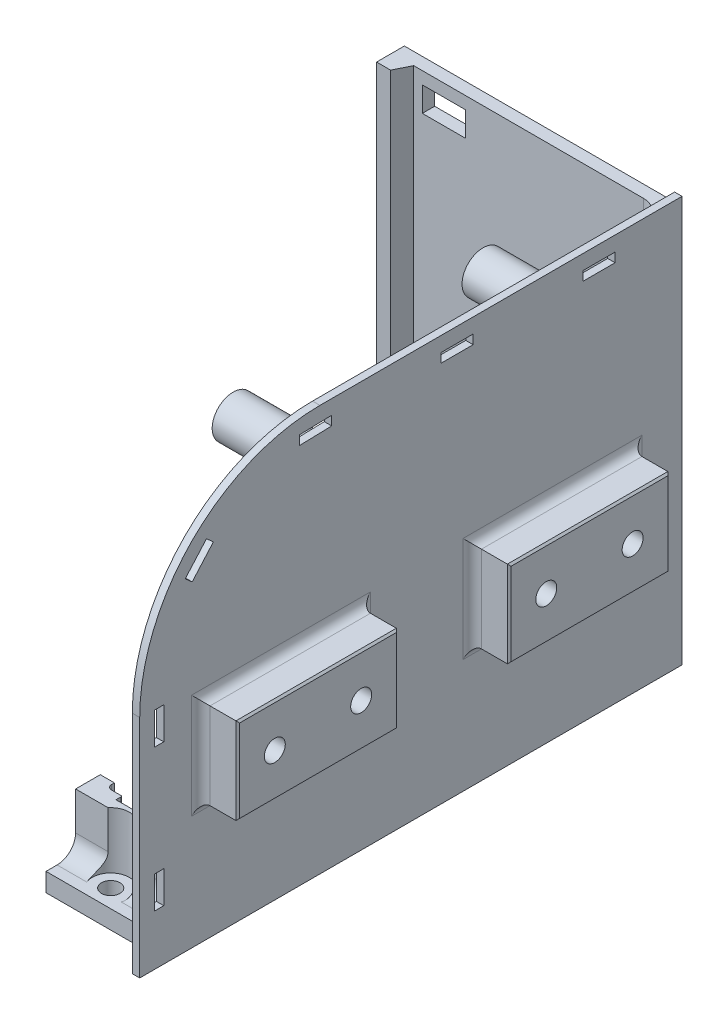
from build123d import *

# Parameters (mm, degrees)
EXTRUDE_1_DEPTH                 = 2
EXTRUDE_2_DEPTH                 = 1.2
SKETCH_4_R                      = 1.55
EXTRUDE_3_DEPTH                 = 4
EXTRUDE_START                   = 3
SKETCH_4_3_R                    = 1.55
EXTRUDE_4_DEPTH                 = 4
FILLET_1_R                      = 3
SKETCH_5_W                      = 3.5
SKETCH_5_H                      = 2.5
EXTRUDE_5_DEPTH                 = 59.375418161
SKETCH_9_W                      = 7
SKETCH_9_H                      = 4
CUT_EXTRUDE_3_DEPTH             = 2
OTHER_START                     = -350.004341608
OTHER_1_OUTLINE_W               = 1.5
OTHER_1_OUTLINE_H               = 5.2
OTHER_1_OUTLINE_W_2             = 5.2
OTHER_1_OUTLINE_H_2             = 1.5
OTHER_1_DEPTH                   = 1.2
SKETCH_10_R                     = 3.4
SKETCH_10_R_2                   = 1.4
EXTRUDE_6_DEPTH                 = 13.8
EXTRUDE_7_DEPTH                 = 2.4
CHAMFER_1_SIZE2                 = 1.219331471
CHAMFER_1_SIZE                  = 2.5
EXTRUDE_9_DEPTH                 = 15.389983971
SKETCH_15_R                     = 1.5
CUT_EXTRUDE_4_DEPTH             = 407.679532375
FILLET_2_R                      = 3
SKETCH_16_R                     = 3
CUT_EXTRUDE_5_DEPTH             = 408.922716855
SKETCH_17_W                     = 26
SKETCH_17_H                     = 14
EXTRUDE_10_DEPTH                = 6
CUT_EXTRUDE_6_REACH             = 113.55
SKETCH_18_R                     = 1.7
CUT_EXTRUDE_6_DIRECTION_2_DEPTH = 112.550133095
PATTERN_LINEAR_1_COUNT          = 2
PATTERN_LINEAR_1_PITCH          = 44
FILLET_3_R                      = 1.5
CHAMFER_2_SIZE                  = 0.3


# Read off the part's stored shape, not the designer's step: Отступ1
# Some blends are built 0.0001 mm under size
with BuildPart() as part:
    # Эскиз2 → Бобышка-Вытянуть1 (new body)
    with BuildSketch(Plane.XY.offset(0.1)):
        Polygon((-376.904341608, -14.952219826), (-393.804341608, -14.952219826), (-393.804341608, 44.423198335), (-348.804341608, 44.423198335), (-348.804341608, -19.952219826), (-376.904341608, -19.952219826), align=None)
    extrude(amount=EXTRUDE_1_DEPTH)

    # Эскиз3 → Бобышка-Вытянуть2 (add)
    with BuildSketch(Plane(origin=(-348.804341608, 0, 0), x_dir=(0, 0, -1), z_dir=(1, 0, 0))):
        with BuildLine():
            Line((-0.1, -19.952219826), (-0.1, 45.823198335))
            Line((-0.1, 45.823198335), (-58.7849644, 45.823198335))
            ThreePointArc((-58.7849644, 45.823198335), (-79.43775717, 37.268531468), (-87.992424037, 16.615738698))
            Line((-87.992424037, 16.615738698), (-87.992424037, -19.952219826))
            Line((-87.992424037, -19.952219826), (-0.1, -19.952219826))
        make_face()
    extrude(amount=-EXTRUDE_2_DEPTH)

    # Эскиз4 → Бобышка-Вытянуть3 (add)
    with BuildSketch(Plane(origin=(0, -17.952219826, 0), x_dir=(1, 0, 0), z_dir=(0, 1, 0))):
        with BuildLine():
            Line((-357.604341608, -2.1), (-357.604341608, -5.7))
            ThreePointArc((-357.604341608, -5.7), (-356.608504664, -8.104163056), (-354.204341608, -9.1))
            Line((-354.204341608, -9.1), (-350.004341608, -9.1))
            Line((-350.004341608, -9.1), (-350.004341608, -2.1))
            Line((-350.004341608, -2.1), (-357.604341608, -2.1))
        make_face()
        with Locations(Location((-354.204341608, -5.7, 0), (0, 0, 270))):
            Circle(SKETCH_4_R, mode=Mode.SUBTRACT)
    extrude(amount=EXTRUDE_3_DEPTH)

    # Эскиз4<3> → Бобышка-Вытянуть4 (add)
    with BuildSketch(Plane(origin=(0, -17.952219826, 0), x_dir=(1, 0, 0), z_dir=(0, 1, 0)).offset(EXTRUDE_START)):
        with BuildLine():
            Line((-390.304341608, -5.7), (-390.304341608, -2.1))
            Line((-390.304341608, -2.1), (-381.365657691, -2.1))
            Line((-381.365657691, -2.1), (-383.84844185, -7.190461899))
            ThreePointArc((-383.84844185, -7.190461899), (-387.669175192, -9.01285822), (-390.304341608, -5.7))
        make_face()
        with Locations(Location((-386.904341608, -5.7, 0), (0, 0, 180))):
            Circle(SKETCH_4_3_R, mode=Mode.SUBTRACT)
    extrude(amount=EXTRUDE_4_DEPTH)

    # Скругление1
    fillet_1_edges = [part.edges().sort_by_distance(p)[0] for p in [
        (-350.004341608, -18.952219826, 2.1),
        (-350.004341608, 15.235489254, 2.1),
    ]]
    fillet(fillet_1_edges, radius=FILLET_1_R)

    # Эскиз5 → Бобышка-Вытянуть5 (add)
    with BuildSketch(Plane(origin=(0, 44.423198335, 0), x_dir=(1, 0, 0), z_dir=(0, 1, 0))):
        with Locations((-392.054341608, -3.35)):
            Rectangle(SKETCH_5_W, SKETCH_5_H)
    extrude(amount=-EXTRUDE_5_DEPTH)

    # Эскиз9 → Вырез-Вытянуть3 (cut)
    with BuildSketch(Plane(origin=(0, 0, 0.1), x_dir=(-1, 0, 0), z_dir=(0, 0, -1))):
        with Locations((385.390488384, 40.423198335)):
            Rectangle(SKETCH_9_W, SKETCH_9_H)
    extrude(amount=-CUT_EXTRUDE_3_DEPTH, mode=Mode.SUBTRACT)

    # Отступ1 outline → Отступ1 (cut)
    with BuildSketch(Plane.YZ.offset(OTHER_START)):
        with Locations((42.673198335, 13.546937644)):
            Rectangle(OTHER_1_OUTLINE_W, OTHER_1_OUTLINE_H)
        with Locations((42.673198335, 36.546937644)):
            Rectangle(OTHER_1_OUTLINE_W, OTHER_1_OUTLINE_H)
        Polygon((41.843105902, 62.072434127), (41.984560077, 56.874358452), (43.484004983, 56.915162541), (43.342550808, 62.113238216), align=None)
        Polygon((31.397725301, 79.490528515), (35.298941914, 76.052431812), (36.290700579, 77.177782758), (32.389483966, 80.615879461), align=None)
        with Locations((13.847780174, 84.842424037)):
            Rectangle(OTHER_1_OUTLINE_W_2, OTHER_1_OUTLINE_H_2)
        with Locations((-9.152219826, 84.842424037)):
            Rectangle(OTHER_1_OUTLINE_W_2, OTHER_1_OUTLINE_H_2)
    extrude(amount=OTHER_1_DEPTH, mode=Mode.SUBTRACT)

    # Эскиз10 → Бобышка-Вытянуть6 (add)
    # profile 1 of 2: a face of its own
    with BuildSketch(Plane.ZY.offset(350.004341608)):
        with Locations(Location((57.85, 36.323198334, 0), (0, 0, 180))):
            Circle(SKETCH_10_R)
        with Locations(Location((57.85, 36.323198334, 0), (0, 0, 180))):
            Circle(SKETCH_10_R_2, mode=Mode.SUBTRACT)
    # profile 2 of 2: a face of its own
    with BuildSketch(Plane.ZY.offset(350.004341608)):
        with Locations(Location((17.35, 36.323198334, 0), (0, 0, 180))):
            Circle(SKETCH_10_R)
        with Locations(Location((17.35, 36.323198334, 0), (0, 0, 180))):
            Circle(SKETCH_10_R_2, mode=Mode.SUBTRACT)
    extrude(amount=EXTRUDE_6_DEPTH)

    # Эскиз12 → Бобышка-Вытянуть7 (add)
    with BuildSketch(Plane.ZY.offset(350.004341608)):
        with BuildLine():
            Line((77.792424037, 16.615738698), (77.792424037, -19.952219826))
            Line((77.792424037, -19.952219826), (79.792424037, -19.952219826))
            Line((79.792424037, -19.952219826), (79.792424037, 16.615738698))
            ThreePointArc((79.792424037, 16.615738698), (73.639481564, 31.470255863), (58.7849644, 37.623198335))
            Line((58.7849644, 37.623198335), (0.1, 37.623198335))
            Line((0.1, 37.623198335), (0.1, 35.623198335))
            Line((0.1, 35.623198335), (58.7849644, 35.623198335))
            ThreePointArc((58.7849644, 35.623198335), (72.225268002, 30.0560423), (77.792424037, 16.615738698))
        make_face()
    extrude(amount=EXTRUDE_7_DEPTH)

    # Фаска1
    chamfer_1_edges = [part.edges().sort_by_distance(p)[0] for p in [
        (-390.304341608, 16.735489254, 4.6),
    ]]
    chamfer_1_side = [part.faces().sort_by_distance(p)[0] for p in [
        (-390.304341608, 16.735489254, 4.575613371),
    ]]
    chamfer(chamfer_1_edges, length=CHAMFER_1_SIZE - 0.0001, length2=CHAMFER_1_SIZE2 - 0.0001, reference=chamfer_1_side[0])  # a hair under: the kernel refuses the full size

    # Эскиз14 → Бобышка-Вытянуть9 (add)
    with BuildSketch(Plane.ZY.offset(350.004341608)):
        Polygon((77.792424037, -16.979951829), (86.592424037, -16.979951829), (86.592424037, -13.979951829), (81.792424037, -13.979951829), (81.792424037, -4.809951829), (77.792424037, -4.809951829), align=None)
    extrude(amount=EXTRUDE_9_DEPTH)

    # Эскиз15 → Вырез-Вытянуть4 (cut, through all)
    with BuildSketch(Plane(origin=(0, -4.809951829, 0), x_dir=(1, 0, 0), z_dir=(0, 1, 0))):
        with Locations(Location((-357.804325578, -83.692424037, 0), (0, 0, 270))):
            Circle(SKETCH_15_R)
        with BuildLine():
            Line((-363.104325578, -78.236115217), (-363.104325578, -76.736115217))
            Line((-363.104325578, -76.736115217), (-352.504325578, -76.736115217))
            Line((-352.504325578, -76.736115217), (-352.504325578, -78.236115217))
            ThreePointArc((-352.504325578, -78.236115217), (-352.738640153, -78.801800642), (-353.304325578, -79.036115217))
            Line((-353.304325578, -79.036115217), (-354.804325578, -79.036115217))
            ThreePointArc((-354.804325578, -79.036115217), (-354.945746935, -79.09469386), (-355.004325578, -79.236115217))
            Line((-355.004325578, -79.236115217), (-355.004325578, -80.036115217))
            Line((-355.004325578, -80.036115217), (-360.604325578, -80.036115217))
            Line((-360.604325578, -80.036115217), (-360.604325578, -79.236115217))
            ThreePointArc((-360.604325578, -79.236115217), (-360.662904222, -79.09469386), (-360.804325578, -79.036115217))
            Line((-360.804325578, -79.036115217), (-362.304325578, -79.036115217))
            ThreePointArc((-362.304325578, -79.036115217), (-362.870011003, -78.801800642), (-363.104325578, -78.236115217))
        make_face()
    extrude(amount=-CUT_EXTRUDE_4_DEPTH, mode=Mode.SUBTRACT)

    # Скругление2
    # the kernel refuses this fillet: 3 mm, written as the material it adds along each edge
    with BuildSketch(Plane(origin=(-350.004341608, -13.979951829, 81.792424037), x_dir=(0, 1, 0), z_dir=(-1, 0, 0))) as fillet_2_piece_1_section:
        with BuildLine():
            CenterArc((FILLET_2_R, -FILLET_2_R), FILLET_2_R, 90, 90)
            Line((0, -FILLET_2_R), (0, 0))
            Line((0, 0), (FILLET_2_R, 0))
        make_face()
    fillet_2_piece_1 = extrude(amount=15.389983971, mode=Mode.PRIVATE)
    fillet_2_piece_1 = fillet_2_piece_1 - Plane(origin=(-357.804325578, -11.764674138, 83.692424037), x_dir=(0, 0, 1), z_dir=(0, 1, 0)) * Cylinder(1.5, 43, mode=Mode.PRIVATE)
    add(fillet_2_piece_1)

    # Эскиз16 → Вырез-Вытянуть5 (cut, through all)
    with BuildSketch(Plane(origin=(0, -13.979951829, 0), x_dir=(1, 0, 0), z_dir=(0, 1, 0))):
        with Locations((-357.804325578, -83.692424037)):
            Circle(SKETCH_16_R)
    extrude(amount=CUT_EXTRUDE_5_DEPTH, mode=Mode.SUBTRACT)

    # Эскиз17 → Бобышка-Вытянуть10 (add)
    with BuildSketch(Plane(origin=(-348.804341608, 0, 0), x_dir=(0, 0, -1), z_dir=(1, 0, 0))):
        with Locations((-21.1, 7.047780174)):
            Rectangle(SKETCH_17_W, SKETCH_17_H)
    extrude_10 = extrude(amount=EXTRUDE_10_DEPTH)

    # Эскиз18 → Вырез-Вытянуть6 (cut, up to next)
    with BuildSketch(Plane(origin=(-342.804341608, 0, 0), x_dir=(0, 0, -1), z_dir=(1, 0, 0)), mode=Mode.PRIVATE) as cut_extrude_6_sk1:
        with Locations((-14.1, 7.047780174)):
            Circle(SKETCH_18_R)
    cut_extrude_6_tool1 = extrude(cut_extrude_6_sk1.sketch, amount=-CUT_EXTRUDE_6_REACH, mode=Mode.PRIVATE) & part.part
    # Эскиз18 → Вырез-Вытянуть6 (cut, up to next)
    with BuildSketch(Plane(origin=(-342.804341608, 0, 0), x_dir=(0, 0, -1), z_dir=(1, 0, 0)), mode=Mode.PRIVATE) as cut_extrude_6_sk2:
        with Locations(Location((-28.1, 7.047780174, 0), (0, 0, 180))):
            Circle(SKETCH_18_R)
    cut_extrude_6_tool2 = extrude(cut_extrude_6_sk2.sketch, amount=-CUT_EXTRUDE_6_REACH, mode=Mode.PRIVATE) & part.part
    cut_extrude_6_1 = cut_extrude_6_tool1.solids().sort_by_distance((-342.804342, 7.04778, 14.1))[0]
    add(cut_extrude_6_1, mode=Mode.SUBTRACT)
    cut_extrude_6_2 = cut_extrude_6_tool2.solids().sort_by_distance((-342.804342, 7.04778, 28.1))[0]
    add(cut_extrude_6_2, mode=Mode.SUBTRACT)
    cut_extrude_6 = cut_extrude_6_1 + cut_extrude_6_2  # Вырез-Вытянуть6 as one shape, for the pattern or mirror that repeats it

    # Эскиз18 → Вырез-Вытянуть6 direction 2 (cut)
    with BuildSketch(Plane(origin=(-342.804341608, 0, 0), x_dir=(0, 0, -1), z_dir=(1, 0, 0))):
        with Locations((-14.1, 7.047780174)):
            Circle(SKETCH_18_R)
        with Locations(Location((-28.1, 7.047780174, 0), (0, 0, 180))):
            Circle(SKETCH_18_R)
    cut_extrude_6_direction_2 = extrude(amount=CUT_EXTRUDE_6_DIRECTION_2_DEPTH, mode=Mode.SUBTRACT)

    # Линейный массив1: Бобышка-Вытянуть10, Вырез-Вытянуть6, Вырез-Вытянуть6 direction 2 ×2
    with Locations(*[(0, 0, i * PATTERN_LINEAR_1_PITCH) for i in range(1, PATTERN_LINEAR_1_COUNT)]):
        add(extrude_10)
        add(cut_extrude_6, mode=Mode.SUBTRACT)
        add(cut_extrude_6_direction_2, mode=Mode.SUBTRACT)

    # Скругление3
    fillet_3_edges = [part.edges().sort_by_distance(p)[0] for p in [
        (-348.804341608, 7.047780174, 8.1),
        (-348.804341608, 14.047780174, 21.1),
        (-348.804341608, 7.047780174, 34.1),
        (-348.804341608, 0.047780174, 21.1),
        (-348.804341608, 7.047780174, 52.1),
        (-348.804341608, 14.047780174, 65.1),
        (-348.804341608, 7.047780174, 78.1),
        (-348.804341608, 0.047780174, 65.1),
    ]]
    fillet(fillet_3_edges, radius=FILLET_3_R)

    # Фаска2
    chamfer_2_edges = [part.edges().sort_by_distance(p)[0] for p in [
        (-342.804341608, 7.047780174, 8.1),
        (-342.804341608, 14.047780174, 21.1),
        (-342.804341608, 7.047780174, 34.1),
        (-342.804341608, 0.047780174, 21.1),
        (-342.804341608, 7.047780174, 52.1),
        (-342.804341608, 14.047780174, 65.1),
        (-342.804341608, 7.047780174, 78.1),
        (-342.804341608, 0.047780174, 65.1),
    ]]
    chamfer(chamfer_2_edges, length=CHAMFER_2_SIZE)


solid = part.part
